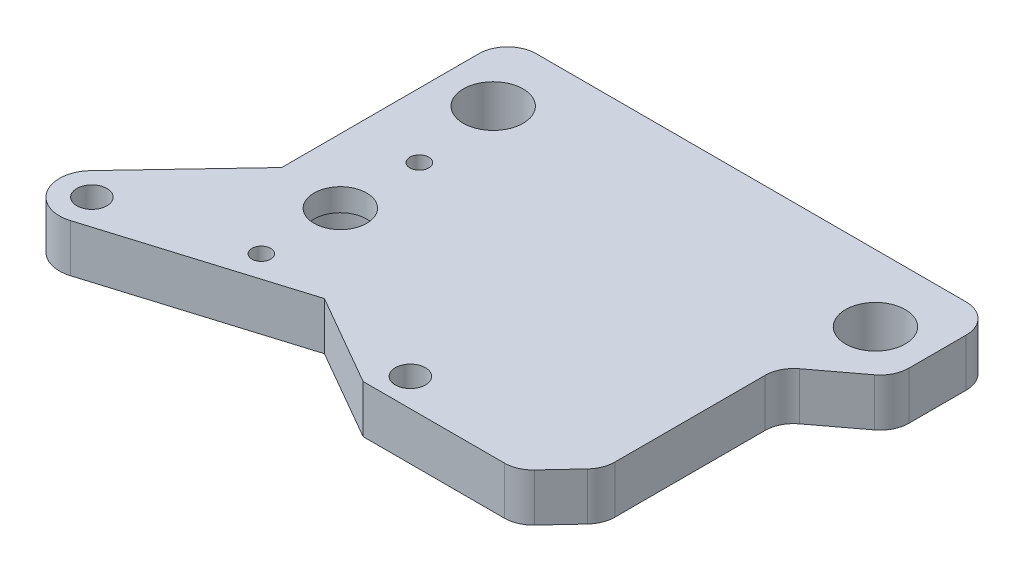
from build123d import *

# Parameters (mm, degrees)
SKETCH4_R           = 2
SKETCH4_R_2         = 1.25
SKETCH4_R_3         = 5.05
SKETCH4_R_4         = 3.96875
BOSS_EXTRUDE2_DEPTH = 6.35
SKETCH33_R          = 6.35
SKETCH33_R_2        = 3.499999985
BOSS_EXTRUDE6_DEPTH = 3


with BuildPart() as part:
    # Sketch4 → Boss-Extrude2 (new body)
    with BuildSketch(Plane(origin=(0, 0, 0), x_dir=(1, 0, 0), z_dir=(0, 1, 0))):
        with BuildLine():
            Line((21.46596982, -18.4375), (40.257702493, -18.4375))
            ThreePointArc((40.257702493, -18.4375), (41.776936446, -18.121498883), (43.044160097, -17.225913752))
            Line((43.044160097, -17.225913752), (46.444939319, -13.579024524))
            ThreePointArc((46.444939319, -13.579024524), (47.203372649, -12.376980446), (47.468481715, -10.980610773))
            Line((47.468481715, -10.980610773), (47.468481715, 8.985116992))
            ThreePointArc((47.468481715, 8.985116992), (47.868781798, 10.685130659), (48.985566477, 12.027918285))
            Line((48.985566477, 12.027918285), (54.680415238, 16.319294633))
            ThreePointArc((54.680415238, 16.319294633), (55.797199918, 17.662082259), (56.1975, 19.362095927))
            Line((56.1975, 19.362095927), (56.1975, 26.9875))
            ThreePointArc((56.1975, 26.9875), (55.081576836, 29.681576836), (52.3875, 30.7975))
            Line((52.3875, 30.7975), (-4.7625, 30.7975))
            ThreePointArc((-4.7625, 30.7975), (-7.456576836, 29.681576836), (-8.5725, 26.9875))
            Line((-8.5725, 26.9875), (-8.5725, 0.781747009))
            Line((-8.5725, 0.781747009), (-20.917416467, -12.27322702))
            ThreePointArc((-20.917416467, -12.27322702), (-21.4498857, -17.515316011), (-16.517810325, -19.369406885))
            Line((-16.517810325, -19.369406885), (9.346561417, -11.463733294))
            Line((9.346561417, -11.463733294), (21.46596982, -18.4375))
        make_face()
        with Locations((-17.78, -15.24)):
            Circle(SKETCH4_R, mode=Mode.SUBTRACT)
        with Locations((0, -10.5)):
            Circle(SKETCH4_R_2, mode=Mode.SUBTRACT)
        Circle(SKETCH4_R_3, mode=Mode.SUBTRACT)
        with Locations((24.012521227, -14.703599027)):
            Circle(SKETCH4_R, mode=Mode.SUBTRACT)
        with Locations((0, 10.5)):
            Circle(SKETCH4_R_2, mode=Mode.SUBTRACT)
        with Locations((-1.5875, 21.9075)):
            Circle(SKETCH4_R_4, mode=Mode.SUBTRACT)
        with Locations((49.2125, 21.9075)):
            Circle(SKETCH4_R_4, mode=Mode.SUBTRACT)
    extrude(amount=-BOSS_EXTRUDE2_DEPTH)

    # Sketch33 → Boss-Extrude6 (add)
    with BuildSketch(Plane(origin=(0, 0, 0), x_dir=(1, 0, 0), z_dir=(0, 1, 0))):
        Circle(SKETCH33_R)
        Circle(SKETCH33_R_2, mode=Mode.SUBTRACT)
    extrude(amount=-BOSS_EXTRUDE6_DEPTH)


solid = part.part
